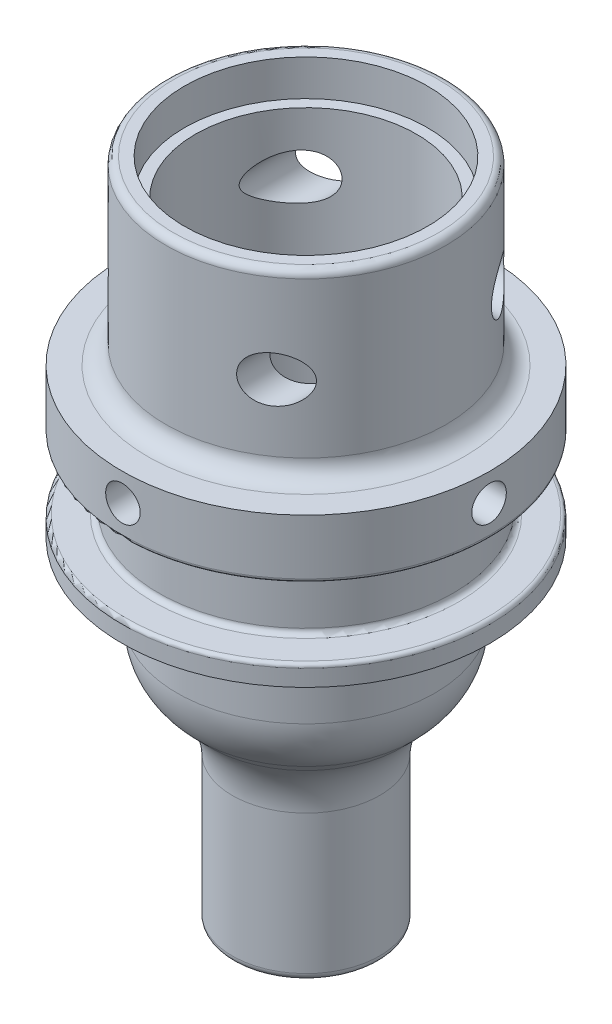
from build123d import *

# Parameters (mm, degrees)
SKETCH3_W         = 0.79375
SKETCH3_H         = 6.3373
CIRPATTERN1_COUNT = 4
CIRPATTERN2_COUNT = 4
FILLET1_R         = 0.254
FILLET2_R         = 1.905
FILLET3_R         = 2.54
FILLET4_R         = 0.635
FILLET5_R         = 0.254


with BuildPart() as part:
    # Sketch1 → Revolve1 (revolve)
    with BuildSketch(Plane.XY):
        with BuildLine():
            Line((4.826, 22.86), (4.826, 16.6243))
            Line((4.826, 16.6243), (6.3373, 16.6243))
            Line((6.3373, 16.6243), (6.3373, 15.2908))
            Line((6.3373, 15.2908), (6.3373, 14.7193))
            ThreePointArc((6.3373, 14.7193), (6.300102561, 14.629497439), (6.2103, 14.5923))
            Line((6.2103, 14.5923), (5.2578, 14.5923))
            ThreePointArc((5.2578, 14.5923), (5.132076414, 14.540223586), (5.08, 14.4145))
            Line((5.08, 14.4145), (5.08, 12.3571))
            ThreePointArc((5.08, 12.3571), (5.132076414, 12.231376414), (5.2578, 12.1793))
            Line((5.2578, 12.1793), (6.2103, 12.1793))
            ThreePointArc((6.2103, 12.1793), (6.300102561, 12.142102561), (6.3373, 12.0523))
            Line((6.3373, 12.0523), (6.3373, 11.4808))
            Line((6.3373, 11.4808), (5.0673, 11.4808))
            Line((5.0673, 11.4808), (4.445, 11.4808))
            Line((4.445, 11.4808), (4.445, 8.001))
            Line((4.445, 8.001), (2.54, 6.096))
            Line((2.54, 6.096), (2.54, 0))
            Line((2.54, 0), (1.905, 0))
            Line((1.905, 0), (1.905, 6.856360521))
            Line((1.905, 6.856360521), (3.81, 8.001))
            Line((3.81, 8.001), (3.81, 21.6154))
            Line((3.81, 21.6154), (4.191, 21.6154))
            Line((4.191, 21.6154), (4.191, 22.86))
            Line((4.191, 22.86), (4.826, 22.86))
        make_face()
    revolve(axis=Axis((0, 20.955, 0), (0, -1, 0)))

    # Sketch3 → 1/16 (0.0625) Diameter Hole1 (revolve, cut)
    with BuildSketch(Plane(origin=(2.794, 19.558, 0), x_dir=(0, 1, 0), z_dir=(1, 0, 0))):
        with Locations((0.396875, 3.16865)):
            Rectangle(SKETCH3_W, SKETCH3_H)
    f_1_16_0_0625_diameter_hole1 = revolve(axis=Axis((2.794, 19.558, -6.35), (0, 0, 1)), mode=Mode.SUBTRACT)

    # CirPattern1: 1/16 (0.0625) Diameter Hole1 ×4 about axis
    cirpattern1_axis = Axis((0, 20.955, 0), (0, 1, 0))
    for i in range(1, CIRPATTERN1_COUNT):
        add(f_1_16_0_0625_diameter_hole1.rotate(cirpattern1_axis, i * 360 / CIRPATTERN1_COUNT), mode=Mode.SUBTRACT)

    # Sketch7 → #0-80 Tapped Hole1 (revolve, cut)
    with BuildSketch(Plane(origin=(0, 15.6718, 6.3373), x_dir=(0, -1, 0), z_dir=(1, 0, 0))):
        Polygon((0, 0), (0, 2.135890611), (0.59563, 1.778), (0.59563, 0), align=None)
    f_0_80_tapped_hole1 = revolve(axis=Axis((0, 15.6718, 12.6873), (0, 0, -1)), mode=Mode.SUBTRACT)

    # CirPattern2: #0-80 Tapped Hole1 ×4 about axis
    cirpattern2_axis = Axis((0, 20.955, 0), (0, 1, 0))
    for i in range(1, CIRPATTERN2_COUNT):
        add(f_0_80_tapped_hole1.rotate(cirpattern2_axis, i * 360 / CIRPATTERN2_COUNT), mode=Mode.SUBTRACT)

    # Fillet1
    fillet1_edges = [part.edges().sort_by_distance(p)[0] for p in [
        (-4.826, 22.86, 0),
    ]]
    fillet(fillet1_edges, radius=FILLET1_R)

    # Fillet2
    fillet2_edges = [part.edges().sort_by_distance(p)[0] for p in [
        (-3.81, 8.001, 0),
        (-1.905, 6.856360521, 0),
    ]]
    fillet(fillet2_edges, radius=FILLET2_R)

    # Fillet3
    fillet3_edges = [part.edges().sort_by_distance(p)[0] for p in [
        (-4.445, 8.001, 0),
        (-2.54, 6.096, 0),
    ]]
    fillet(fillet3_edges, radius=FILLET3_R)

    # Fillet4
    fillet4_edges = [part.edges().sort_by_distance(p)[0] for p in [
        (-4.826, 16.6243, 0),
    ]]
    fillet(fillet4_edges, radius=FILLET4_R)

    # Fillet5
    fillet5_edges = [part.edges().sort_by_distance(p)[0] for p in [
        (-1.905, 0, 0),
        (-2.54, 0, 0),
    ]]
    fillet(fillet5_edges, radius=FILLET5_R)


solid = part.part
